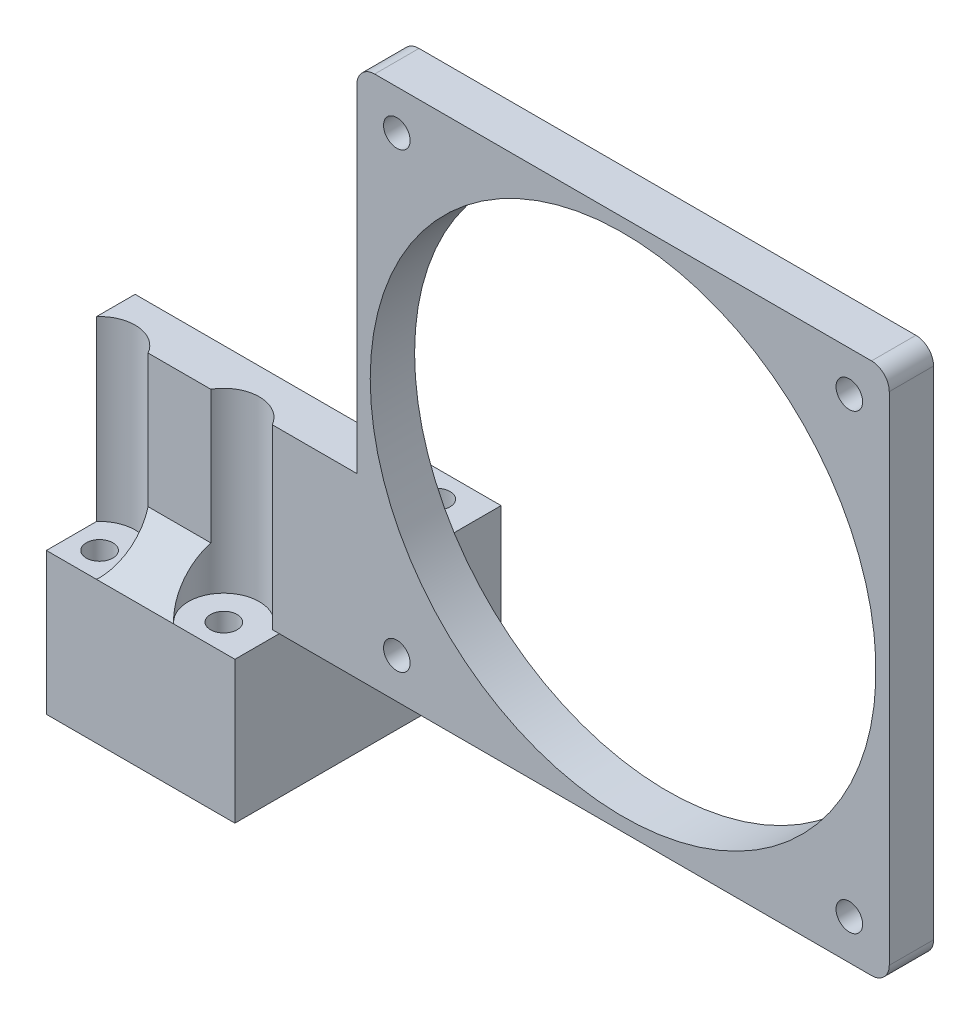
from build123d import *

# Parameters (mm, degrees)
SKETCH_1_W          = 60
SKETCH_1_H          = 60
EXTRUDE_1_DEPTH     = 5
SKETCH_2_R          = 1.5
CUT_EXTRUDE_1_DEPTH = 5
SKETCH_3_R          = 28.5
CUT_EXTRUDE_2_DEPTH = 5
SKETCH_4_W          = 5
SKETCH_4_H          = 20
EXTRUDE_2_DEPTH     = 30
SKETCH_5_W          = 21.25
SKETCH_5_H          = 30
EXTRUDE_3_DEPTH     = 16
SKETCH_6_R          = 1.5
CUT_EXTRUDE_3_DEPTH = 30
SKETCH_7_R          = 4
CUT_EXTRUDE_4_DEPTH = 30
CHAMFER_1_SIZE      = 10
CHAMFER_2_SIZE      = 5
FILLET_1_R          = 2


with BuildPart() as part:
    # 草图1 → 凸台-拉伸1 (new body)
    with BuildSketch(Plane.XY):
        with Locations((-30, 30)):
            Rectangle(SKETCH_1_W, SKETCH_1_H)
    extrude(amount=EXTRUDE_1_DEPTH)

    # 草图2 → 切除-拉伸1 (cut)
    with BuildSketch(Plane(origin=(0, 0, 0), x_dir=(-1, 0, 0), z_dir=(0, 0, -1))):
        with Locations((4.5, 55.5)):
            Circle(SKETCH_2_R)
        with Locations((55.5, 55.5)):
            Circle(SKETCH_2_R)
        with Locations((4.5, 4.5)):
            Circle(SKETCH_2_R)
        with Locations((55.5, 4.5)):
            Circle(SKETCH_2_R)
    extrude(amount=-CUT_EXTRUDE_1_DEPTH, mode=Mode.SUBTRACT)

    # 草图3 → 切除-拉伸2 (cut)
    with BuildSketch(Plane(origin=(0, 0, 0), x_dir=(-1, 0, 0), z_dir=(0, 0, -1))):
        with Locations((30, 30)):
            Circle(SKETCH_3_R)
    extrude(amount=-CUT_EXTRUDE_2_DEPTH, mode=Mode.SUBTRACT)

    # 草图4 → 凸台-拉伸2 (add)
    with BuildSketch(Plane.ZY.offset(60)):
        with Locations((2.5, 10)):
            Rectangle(SKETCH_4_W, SKETCH_4_H)
    extrude(amount=EXTRUDE_2_DEPTH)

    # 草图5 → 凸台-拉伸3 (add)
    with BuildSketch(Plane.XZ):
        with Locations((-79.375, -5)):
            Rectangle(SKETCH_5_W, SKETCH_5_H)
    extrude(amount=EXTRUDE_3_DEPTH)

    # 草图6 → 切除-拉伸3 (cut)
    with BuildSketch(Plane.XZ.offset(16)):
        with Locations(Location((-87, 7, 0), (0, 0, 270))):
            Circle(SKETCH_6_R)
        with Locations(Location((-73, 7, 0), (0, 0, 270))):
            Circle(SKETCH_6_R)
        with Locations(Location((-87, -17, 0), (0, 0, 270))):
            Circle(SKETCH_6_R)
        with Locations(Location((-73, -17, 0), (0, 0, 270))):
            Circle(SKETCH_6_R)
    extrude(amount=-CUT_EXTRUDE_3_DEPTH, mode=Mode.SUBTRACT)

    # 草图7 → 切除-拉伸4 (cut)
    with BuildSketch(Plane(origin=(0, 0, 0), x_dir=(1, 0, 0), z_dir=(0, 1, 0))):
        with Locations((-87, -7)):
            Circle(SKETCH_7_R)
        with Locations((-73, -7)):
            Circle(SKETCH_7_R)
    extrude(amount=CUT_EXTRUDE_4_DEPTH, mode=Mode.SUBTRACT)

    # 倒角1
    chamfer_1_edges = [part.edges().sort_by_distance(p)[0] for p in [
        (-79.375, 0, 0),
    ]]
    chamfer(chamfer_1_edges, length=CHAMFER_1_SIZE)

    # 倒角2
    chamfer_2_edges = [part.edges().sort_by_distance(p)[0] for p in [
        (-80, 0, 5),
    ]]
    chamfer(chamfer_2_edges, length=CHAMFER_2_SIZE - 0.0001)  # a hair under: the kernel refuses the full size

    # 圆角1
    fillet_1_edges = [part.edges().sort_by_distance(p)[0] for p in [
        (0, 0, 2.5),
        (-60, 60, 2.5),
        (0, 60, 2.5),
    ]]
    fillet(fillet_1_edges, radius=FILLET_1_R)


solid = part.part
